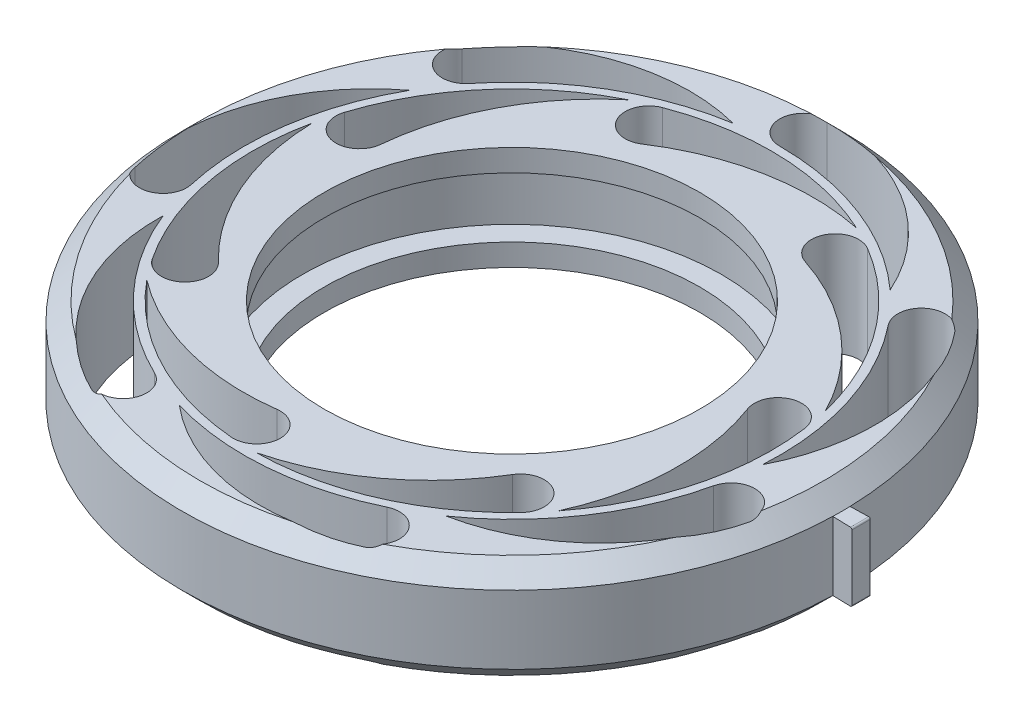
from build123d import *

# Parameters (mm, degrees)
CHAMFER1_SIZE      = 1.125
CUT_EXTRUDE1_DEPTH = 31.319486308
REVOLVE2_ANGLE     = 3


with BuildPart() as part:
    # Sketch1 → Revolve1 (revolve)
    with BuildSketch(Plane.XY):
        Polygon((11.925, -4.3), (11.925, -2.9), (13.3, -2.9), (13.3, 0.9), (11.925, 0.9), (11.925, 2.3), (20.925, 2.3), (20.925, -4.3), align=None)
    revolve(axis=Axis((0, 0, 0), (0, -1, 0)))

    # Chamfer1
    chamfer1_edges = [part.edges().sort_by_distance(p)[0] for p in [
        (-20.925, 2.3, 0),
        (-20.925, -4.3, 0),
    ]]
    chamfer(chamfer1_edges, length=CHAMFER1_SIZE)

    # Sketch5 → Cut-Extrude1 (cut, through all)
    with BuildSketch(Plane(origin=(0, 2.3, 0), x_dir=(1, 0, 0), z_dir=(0, 1, 0))):
        with BuildLine():
            ThreePointArc((0, 20), (6.800735254, 17.988088482), (11.412274094, 12.6))
            ThreePointArc((11.412274094, 12.6), (6.115553941, 15.861904047), (0, 17))
            ThreePointArc((0, 17), (-1.5, 18.5), (0, 20))
        make_face()
        with BuildLine():
            ThreePointArc((-5.841640889, 15.40251722), (-6.645816671, 13.318214416), (-4.486211402, 12.746268657))
            ThreePointArc((-4.486211402, 12.746268657), (1.006943302, 14.975750929), (6.935198115, 14.942065858))
            ThreePointArc((6.935198115, 14.942065858), (0.593271199, 16.462391512), (-5.841640889, 15.40251722))
        make_face()
        with BuildLine():
            ThreePointArc((7.168327062, 11.45462983), (12.33633243, 8.549968005), (16.006202799, 3.894069458))
            ThreePointArc((16.006202799, 3.894069458), (13.240714503, 9.800295121), (8.399969352, 14.170491166))
            ThreePointArc((8.399969352, 14.170491166), (6.269000401, 13.499679567), (7.168327062, 11.45462983))
        make_face()
        with BuildLine():
            ThreePointArc((13.291135202, 10.599326632), (16.214321471, 5.108402808), (16.966513193, -1.06650367))
            ThreePointArc((16.966513193, -1.06650367), (18.303842961, 5.898360797), (15.636629649, 12.469796037))
            ThreePointArc((15.636629649, 12.469796037), (13.528647723, 12.707308558), (13.291135202, 10.599326632))
        make_face()
        with BuildLine():
            ThreePointArc((13.424969041, 1.53742111), (14.376211623, -4.314115215), (13.024210309, -10.086240669))
            ThreePointArc((13.024210309, -10.086240669), (15.917629725, -4.241623386), (16.316231342, 2.267796239))
            ThreePointArc((16.316231342, 2.267796239), (14.463132307, 3.515610662), (13.424969041, 1.53742111))
        make_face()
        with BuildLine():
            ThreePointArc((16.573774507, -3.782855877), (14.103374221, -9.491829938), (9.744621803, -13.929908324))
            ThreePointArc((9.744621803, -13.929908324), (16.023783587, -10.632952872), (19.498558244, -4.450418679))
            ThreePointArc((19.498558244, -4.450418679), (18.369947776, -2.65424541), (16.573774507, -3.782855877))
        make_face()
        with BuildLine():
            ThreePointArc((9.572335513, -9.537497064), (5.590510242, -13.929581686), (0.234721811, -16.47140585))
            ThreePointArc((0.234721811, -16.47140585), (6.608245103, -15.089512969), (11.946038342, -11.342595511))
            ThreePointArc((11.946038342, -11.342595511), (11.766230592, -9.115784778), (9.572335513, -9.537497064))
        make_face()
        with BuildLine():
            ThreePointArc((7.376023565, -15.316470754), (1.372298527, -16.944521143), (-4.815168558, -16.303807891))
            ThreePointArc((-4.815168558, -16.303807891), (1.677488347, -19.157436156), (8.677674782, -18.019377358))
            ThreePointArc((8.677674782, -18.019377358), (9.378302476, -16.017098448), (7.376023565, -15.316470754))
        make_face()
        with BuildLine():
            ThreePointArc((-1.488461896, -13.430485419), (-7.404959376, -13.055789036), (-12.731516999, -10.453266471))
            ThreePointArc((-12.731516999, -10.453266471), (-7.677282864, -14.574691517), (-1.419765185, -16.411781494))
            ThreePointArc((-1.419765185, -16.411781494), (0.209117253, -14.882808351), (-1.488461896, -13.430485419))
        make_face()
        with BuildLine():
            ThreePointArc((-7.376023565, -15.316470754), (-12.392145948, -11.637642322), (-15.749038784, -6.40060758))
            ThreePointArc((-15.749038784, -6.40060758), (-13.931989833, -13.255979274), (-8.677674782, -18.019377358))
            ThreePointArc((-8.677674782, -18.019377358), (-6.675395872, -17.318749665), (-7.376023565, -15.316470754))
        make_face()
        with BuildLine():
            ThreePointArc((-11.428417138, -7.210044322), (-14.824343551, -2.350720952), (-16.110663832, 3.436395769))
            ThreePointArc((-16.110663832, 3.436395769), (-16.181660247, -3.084830083), (-13.716456569, -9.122561273))
            ThreePointArc((-13.716456569, -9.122561273), (-11.505465642, -9.442773682), (-11.428417138, -7.210044322))
        make_face()
        with BuildLine():
            ThreePointArc((-16.573774507, -3.782855877), (-16.82505177, 2.432618532), (-14.823561583, 8.322380788))
            ThreePointArc((-14.823561583, 8.322380788), (-19.050395508, 2.627500374), (-19.498558244, -4.450418679))
            ThreePointArc((-19.498558244, -4.450418679), (-17.702384974, -5.579029146), (-16.573774507, -3.782855877))
        make_face()
        with BuildLine():
            ThreePointArc((-12.762541178, 4.439707208), (-11.08069467, 10.124487954), (-7.358152203, 14.738381905))
            ThreePointArc((-7.358152203, 14.738381905), (-12.500917418, 10.727971323), (-15.684376393, 5.036133653))
            ThreePointArc((-15.684376393, 5.036133653), (-14.55619824, 3.107862167), (-12.762541178, 4.439707208))
        make_face()
        with BuildLine():
            ThreePointArc((-13.291135202, 10.599326632), (-8.588350441, 14.671068015), (-2.735640165, 16.778446677))
            ThreePointArc((-2.735640165, 16.778446677), (-9.823464808, 16.532418649), (-15.636629649, 12.469796037))
            ThreePointArc((-15.636629649, 12.469796037), (-15.399117128, 10.361814111), (-13.291135202, 10.599326632))
        make_face()
    extrude(amount=-CUT_EXTRUDE1_DEPTH, mode=Mode.SUBTRACT)

    # Sketch3 → Revolve2 (revolve, symmetric)
    with BuildSketch(Plane.XY) as revolve2_sk:
        with BuildLine():
            Line((20.925, 1.175), (22.075, 1.175))
            ThreePointArc((22.075, 1.175), (22.145710678, 1.145710678), (22.175, 1.075))
            Line((22.175, 1.075), (22.175, -3.075))
            ThreePointArc((22.175, -3.075), (22.145710678, -3.145710678), (22.075, -3.175))
            Line((22.075, -3.175), (20.925, -3.175))
            Line((20.925, -3.175), (20.925, 1.175))
        make_face()
    revolve(axis=Axis((0, 0, 0), (0, -1, 0)), revolution_arc=REVOLVE2_ANGLE / 2)
    revolve(revolve2_sk.sketch, axis=Axis((0, 0, 0), (0, 1, 0)), revolution_arc=REVOLVE2_ANGLE / 2)


solid = part.part
